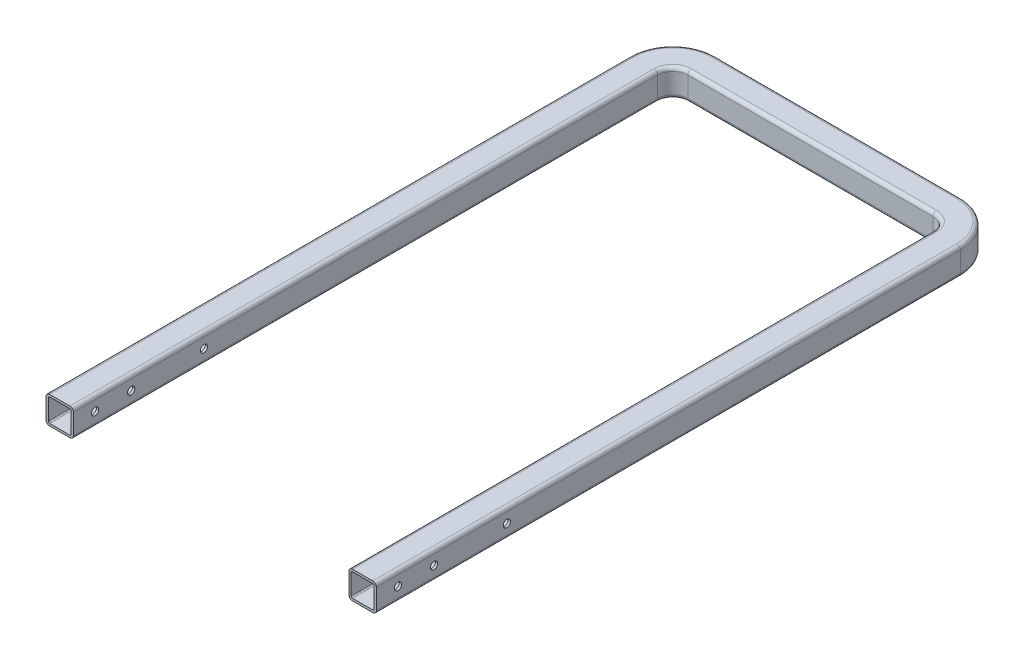
from build123d import *

# Parameters (mm, degrees)
CUT_EXTRUDE2_DEPTH      = 974.845833675
CUT_EXTRUDE2_DEPTH_BACK = 974.845833675
SKETCH4_R               = 5


with BuildPart() as part:
    # Sweep-Thin1: sweep along a path in Sketch1
    with BuildLine(Plane(origin=(0, 0, 0), x_dir=(1, 0, 0), z_dir=(0, 1, 0))) as sweep_thin1_path:
        Line((0, 0), (0, 810))
        ThreePointArc((0, 810), (11.715728753, 838.284271247), (40, 850))
        Line((40, 850), (380, 850))
        ThreePointArc((380, 850), (408.284271247, 838.284271247), (420, 810))
        Line((420, 810), (420, 0))
    # Sketch3 → Sweep-Thin1 (sweep)
    with BuildSketch(Plane.XY):
        with BuildLine():
            Line((14.05, 19.05), (-14.05, 19.05))
            ThreePointArc((-14.05, 19.05), (-17.585533906, 17.585533906), (-19.05, 14.05))
            Line((-19.05, 14.05), (-19.05, -14.05))
            ThreePointArc((-19.05, -14.05), (-17.585533906, -17.585533906), (-14.05, -19.05))
            Line((-14.05, -19.05), (14.05, -19.05))
            ThreePointArc((14.05, -19.05), (17.585533906, -17.585533906), (19.05, -14.05))
            Line((19.05, -14.05), (19.05, 14.05))
            ThreePointArc((19.05, 14.05), (17.585533906, 17.585533906), (14.05, 19.05))
        make_face()
        with BuildLine():
            Line((14.05, 15.875), (-14.05, 15.875))
            ThreePointArc((-14.05, 15.875), (-15.340469876, 15.340469876), (-15.875, 14.05))
            Line((-15.875, 14.05), (-15.875, -14.05))
            ThreePointArc((-15.875, -14.05), (-15.340469876, -15.340469876), (-14.05, -15.875))
            Line((-14.05, -15.875), (14.05, -15.875))
            ThreePointArc((14.05, -15.875), (15.340469876, -15.340469876), (15.875, -14.05))
            Line((15.875, -14.05), (15.875, 14.05))
            ThreePointArc((15.875, 14.05), (15.340469876, 15.340469876), (14.05, 15.875))
        make_face(mode=Mode.SUBTRACT)
    sweep(path=sweep_thin1_path.line)

    # Sketch4 → Cut-Extrude2 (cut, two sides: drawn at the far end of the back side and taken through both)
    with BuildSketch(Plane(origin=(0, 0, 0), x_dir=(0, 0, -1), z_dir=(1, 0, 0)).offset(-CUT_EXTRUDE2_DEPTH_BACK)):
        with Locations((30, 0)):
            Circle(SKETCH4_R)
        with Locations((80, 0)):
            Circle(SKETCH4_R)
        with Locations((180.955115779, 0)):
            Circle(SKETCH4_R)
    extrude(amount=CUT_EXTRUDE2_DEPTH + CUT_EXTRUDE2_DEPTH_BACK, mode=Mode.SUBTRACT)


solid = part.part
